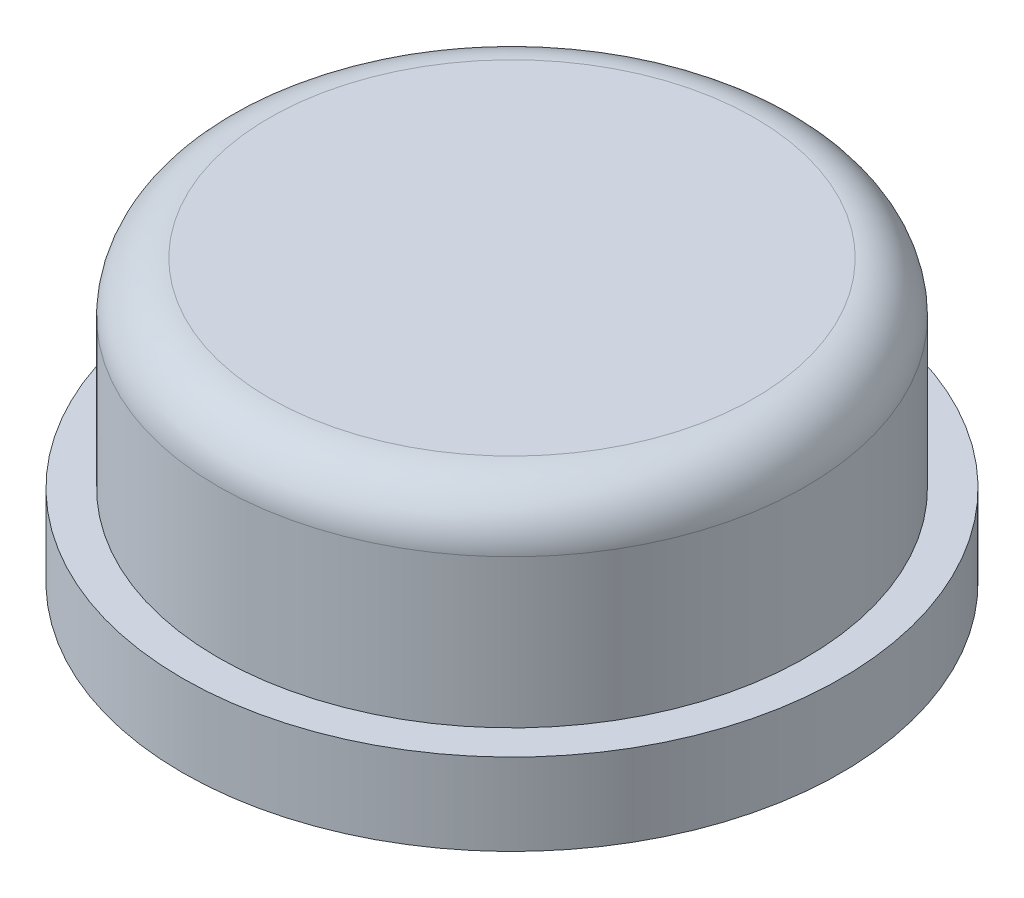
from build123d import *

# Parameters (mm, degrees)
BOSS_EXTRUDE1_START = 4.5
BOSS_EXTRUDE1_DEPTH = 4.5
LOFT3_START         = -1.8
LOFT3_DEPTH         = 3.6
CIRPATTERN4_COUNT   = 4


# Read off the part's stored shape, not the designer's step: Loft3
with BuildPart() as part:
    # Sketch3 → Revolve1 (revolve)
    with BuildSketch(Plane.XY, mode=Mode.PRIVATE) as revolve1_sk:
        with BuildLine():
            Line((0, 5.5), (0, 4.5))
            Line((0, 4.5), (4.75, 4.5))
            Line((4.75, 4.5), (4.75, 0))
            Line((4.75, 0), (6.45, 0))
            Line((6.45, 0), (6.45, 1.6))
            Line((6.45, 1.6), (5.75, 1.6))
            Line((5.75, 1.6), (5.75, 4.5))
            ThreePointArc((5.75, 4.5), (5.457106781, 5.207106781), (4.75, 5.5))
            Line((4.75, 5.5), (0, 5.5))
        make_face()
    revolve(revolve1_sk.sketch.rotate(Axis((0, 5.775, 0), (0, -1, 0)), 90), axis=Axis((0, 5.775, 0), (0, -1, 0)))

    # Sketch4 → Boss-Extrude1 (add)
    with BuildSketch(Plane.XZ.offset(-4.5).offset(BOSS_EXTRUDE1_START)):
        with BuildLine():
            Line((2.75, -0.5), (2.75, 0.5))
            Line((2.75, 0.5), (4.723610907, 0.5))
            ThreePointArc((4.723610907, 0.5), (4.75, 0), (4.723610907, -0.5))
            Line((4.723610907, -0.5), (2.75, -0.5))
        make_face()
        with BuildLine():
            Line((0.5, -2.75), (0.5, -4.723610907))
            ThreePointArc((0.5, -4.723610907), (0, -4.75), (-0.5, -4.723610907))
            Line((-0.5, -4.723610907), (-0.5, -2.75))
            Line((-0.5, -2.75), (0.5, -2.75))
        make_face()
        with BuildLine():
            Line((-2.75, -0.5), (-4.723610907, -0.5))
            ThreePointArc((-4.723610907, -0.5), (-4.75, 0), (-4.723610907, 0.5))
            Line((-4.723610907, 0.5), (-2.75, 0.5))
            Line((-2.75, 0.5), (-2.75, -0.5))
        make_face()
        with BuildLine():
            Line((-0.5, 2.75), (-0.5, 4.723610907))
            ThreePointArc((-0.5, 4.723610907), (0, 4.75), (0.5, 4.723610907))
            Line((0.5, 4.723610907), (0.5, 2.75))
            Line((0.5, 2.75), (-0.5, 2.75))
        make_face()
    extrude(amount=-BOSS_EXTRUDE1_DEPTH)

    # Loft3 outline → Loft3 (add)
    with BuildSketch(Plane.XY.offset(LOFT3_START)):
        with BuildLine():
            Line((2.75, 4.5), (1.9, 4.5))
            add(Edge.make_bspline(
                [(1.9, 4.5), (1.9, 2.6), (1.9, 0.7), (1.9, -1.641532008), (2.258467992, -2), (2.7, -2)],
                knots=[0, 0, 0, 0, 0.811434562, 0.811434562, 1, 1, 1, 1], degree=3))
            Line((2.7, -2), (2.75, -2))
            Line((2.75, -2), (2.75, 4.5))
        make_face()
    loft3 = extrude(amount=LOFT3_DEPTH)

    # CirPattern4: Loft3 ×4 about axis
    cirpattern4_axis = Axis((0, 5.775, 0), (0, -1, 0))
    for i in range(1, CIRPATTERN4_COUNT):
        add(loft3.rotate(cirpattern4_axis, i * 360 / CIRPATTERN4_COUNT))


solid = part.part
